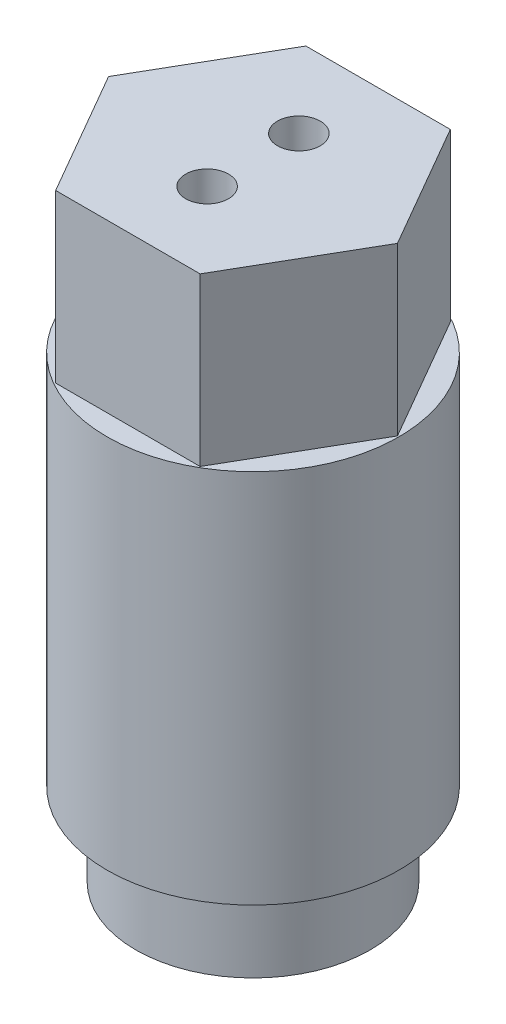
from build123d import *

# Parameters (mm, degrees)
MAIN_BODY_PROFILE_R     = 11.1125
MAIN_BODY_EXTRUDE_DEPTH = 28.575
HEXAGON_BODY_DEPTH      = 12.7
TIP_PROFILE_R           = 8.9281
TIP_BODY_DEPTH          = 6.35
BACK_POWDER_HOLE_D      = 12.7
BACK_POWDER_HOLE_DEPTH  = 31.109535069
BACK_POWDER_HOLE_TIP    = 3.815464931
SCREW_HOLES_AT_2_COUNT  = 2
SCREW_HOLES_AT_2_PITCH  = 6.985
SKETCH12_R              = 2.8575
THROUGH_HOLES_DEPTH     = 44.206104367


with BuildPart() as part:
    # Main Body Profile → Main Body Extrude (new body)
    with BuildSketch(Plane(origin=(0, 0, 0), x_dir=(1, 0, 0), z_dir=(0, 1, 0))):
        Circle(MAIN_BODY_PROFILE_R)
    extrude(amount=MAIN_BODY_EXTRUDE_DEPTH)

    # Hexagon Profile → Hexagon Body (add)
    with BuildSketch(Plane(origin=(0, 28.575, 0), x_dir=(1, 0, 0), z_dir=(0, 1, 0))):
        Polygon((5.499261314, 9.525), (-5.499261314, 9.525), (-10.998522628, 0), (-5.499261314, -9.525), (5.499261314, -9.525), (10.998522628, 0), align=None)
    extrude(amount=HEXAGON_BODY_DEPTH)

    # Tip Profile → Tip Body (add)
    with BuildSketch(Plane.XZ):
        Circle(TIP_PROFILE_R)
    extrude(amount=TIP_BODY_DEPTH)

    # Back Powder Hole
    with Locations(Plane(origin=(0, -6.35, 0), x_dir=(-1, 0, 0), z_dir=(0, -1, 0))):
        with Locations((0, 0)):
            Hole(BACK_POWDER_HOLE_D / 2, depth=BACK_POWDER_HOLE_DEPTH)
            with Locations((0, 0, -(BACK_POWDER_HOLE_DEPTH + BACK_POWDER_HOLE_TIP / 2))):  # 118° drill point
                Cone(0, BACK_POWDER_HOLE_D / 2, BACK_POWDER_HOLE_TIP, mode=Mode.SUBTRACT)

    # Sketch11 → Screw Holes (revolve, cut)
    with BuildSketch(Plane(origin=(0, 33.896641376, 3.4925), x_dir=(0, 0, -1), z_dir=(1, 0, 0))):
        Polygon((0, 0), (0, 7.378358624), (1.63195, 7.378358624), (1.63195, 1.028358553), (2.8575, 0), align=None)
    screw_holes = revolve(axis=Axis((0, 27.546641376, 3.4925), (0, 1, 0)), mode=Mode.SUBTRACT)

    # Screw Holes at 2: Screw Holes ×2
    with Locations(*[(0, 0, -i * SCREW_HOLES_AT_2_PITCH) for i in range(1, SCREW_HOLES_AT_2_COUNT)]):
        add(screw_holes, mode=Mode.SUBTRACT)

    # Sketch12 → Through Holes (cut, through all)
    with BuildSketch(Plane(origin=(0, 33.896641376, 0), x_dir=(1, 0, 0), z_dir=(0, 1, 0))):
        with Locations((0, 3.4925)):
            Circle(SKETCH12_R)
        with Locations((0, -3.4925)):
            Circle(SKETCH12_R)
    extrude(amount=-THROUGH_HOLES_DEPTH, mode=Mode.SUBTRACT)

    # Sketch13 → Revolved Cut (revolve, cut)
    with BuildSketch(Plane.XY):
        Polygon((-8.9281, 0), (-7.696200006, 0), (-8.9281, -0.7112378), align=None)
    revolve(axis=Axis((0, 0, 0), (0, -1, 0)), mode=Mode.SUBTRACT)


solid = part.part
